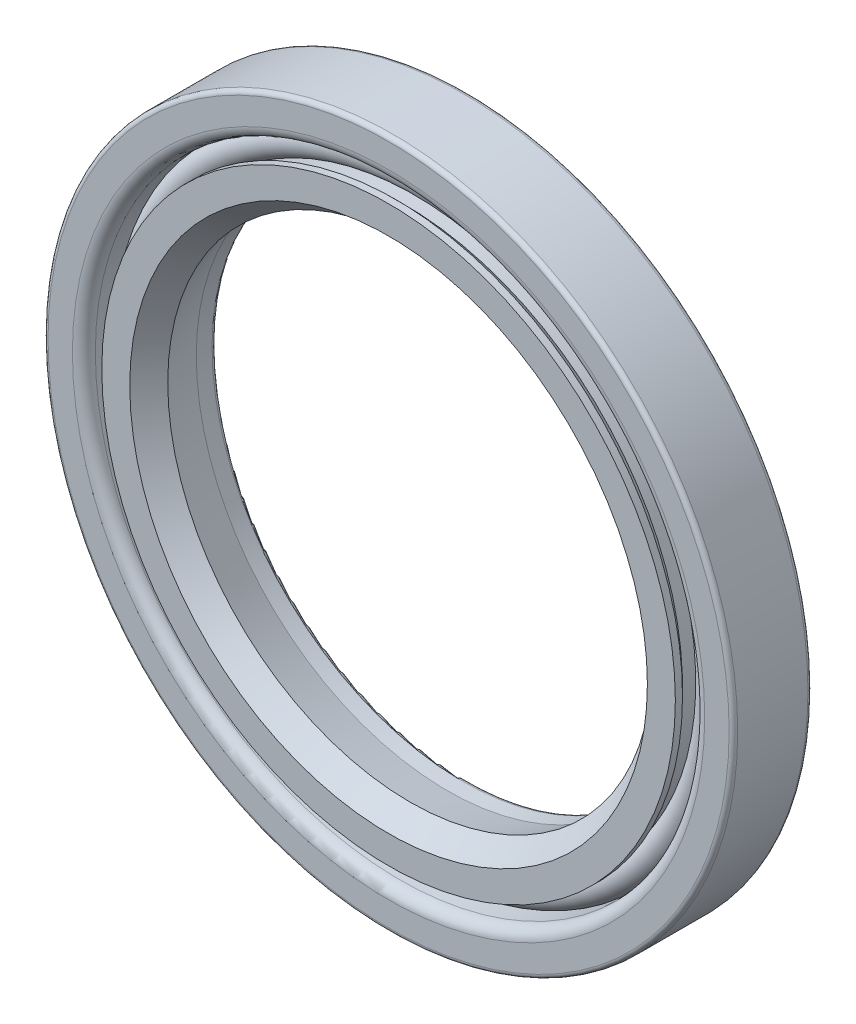
from build123d import *

# Parameters (mm, degrees)
SKETCH2_R = 1


with BuildPart() as part:
    # Sketch1 → Revolve1 (revolve)
    with BuildSketch(Plane(origin=(0, 0, 0), x_dir=(0, 0, -1), z_dir=(1, 0, 0))):
        with BuildLine():
            Line((0, 17.81), (0, 23.75))
            ThreePointArc((0, 23.75), (-0.087867966, 23.962132034), (-0.3, 24.05))
            Line((-0.3, 24.05), (-5.2, 24.05))
            ThreePointArc((-5.2, 24.05), (-5.412132034, 23.962132034), (-5.5, 23.75))
            Line((-5.5, 23.75), (-5.5, 22.05))
            ThreePointArc((-5.5, 22.05), (-5.265685425, 21.484314575), (-4.7, 21.25))
            Line((-4.7, 21.25), (-3.3, 21.25))
            ThreePointArc((-3.3, 21.25), (-2.734314575, 21.015685425), (-2.5, 20.45))
            Line((-2.5, 20.45), (-2.5, 20.25))
            ThreePointArc((-2.5, 20.25), (-2.734314575, 19.684314575), (-3.3, 19.45))
            Line((-3.3, 19.45), (-4.45, 19.45))
            Line((-4.45, 19.45), (-5, 20))
            Line((-5, 20), (-5.5, 20))
            Line((-5.5, 20), (-5.5, 18.05))
            Line((-5.5, 18.05), (-4, 16.9))
            Line((-4, 16.9), (-1.4, 17.51))
            Line((-1.4, 17.51), (-0.3, 17.51))
            ThreePointArc((-0.3, 17.51), (-0.087867966, 17.597867966), (0, 17.81))
        make_face()
    revolve(axis=Axis((0, 0, 0), (0, 0, 1)))


with BuildPart() as body_2:
    # Sketch2 → Revolve2 (revolve)
    with BuildSketch(Plane(origin=(0, 0, 0), x_dir=(0, 0, -1), z_dir=(1, 0, 0))):
        with Locations((-3, 20.33882619)):
            Circle(SKETCH2_R)
    revolve(axis=Axis((0, 0, 0), (0, 0, 1)))


with BuildPart() as body_3:
    # Sketch3 → Revolve4 (revolve)
    with BuildSketch(Plane(origin=(0, 0, 0), x_dir=(0, 0, -1), z_dir=(1, 0, 0))):
        with BuildLine():
            Line((-4.5, 23.05), (-1.4, 23.05))
            ThreePointArc((-1.4, 23.05), (-0.834314575, 22.815685425), (-0.6, 22.25))
            Line((-0.6, 22.25), (-0.6, 19.45))
            Line((-0.6, 19.45), (-0.9, 19.45))
            Line((-0.9, 19.45), (-0.9, 22.25))
            ThreePointArc((-0.9, 22.25), (-1.046446609, 22.603553391), (-1.4, 22.75))
            Line((-1.4, 22.75), (-4.5, 22.75))
            Line((-4.5, 22.75), (-4.5, 23.05))
        make_face()
    revolve(axis=Axis((0, 0, 0), (0, 0, 1)))


solid = Compound([part.part, body_2.part, body_3.part])
